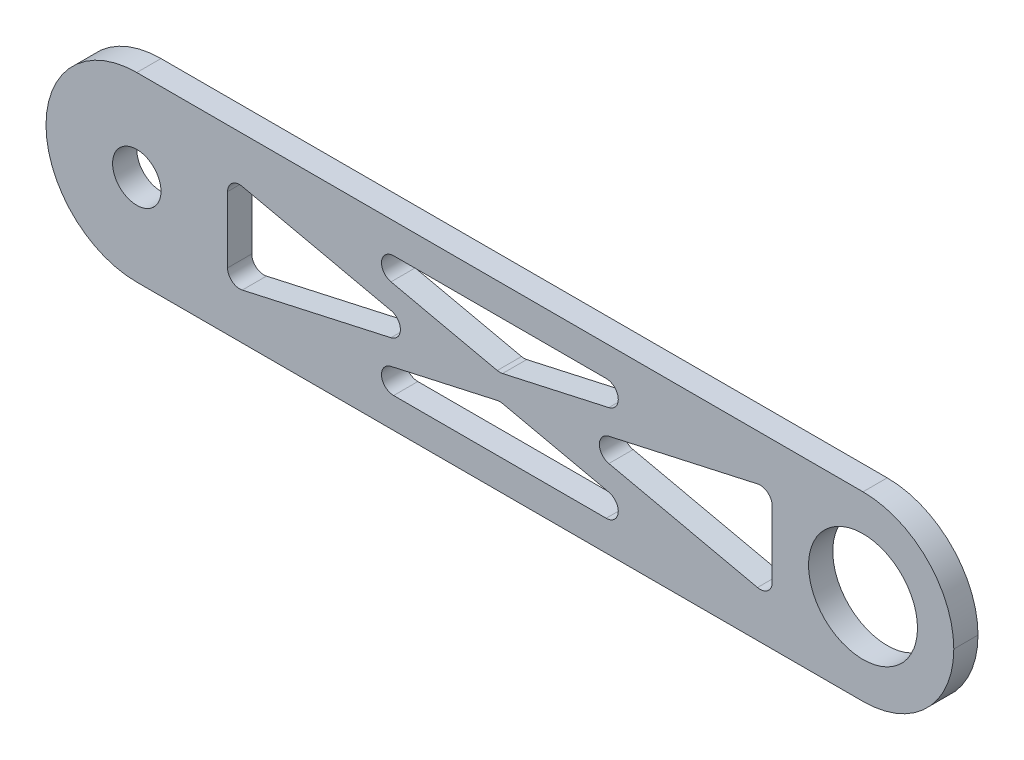
from build123d import *

# Parameters (mm, degrees)
SKETCH_1_W          = 75
SKETCH_1_H          = 15
EXTRUDE_1_DEPTH     = 2
FILLET_1_R          = 7.5
SKETCH_2_R          = 4.5
SKETCH_2_R_2        = 2
CUT_EXTRUDE_1_DEPTH = 2
CUT_EXTRUDE_3_DEPTH = 10
FILLET_5_R          = 1


with BuildPart() as part:
    # 草图1 → 凸台-拉伸1 (new body)
    with BuildSketch(Plane.XY):
        Rectangle(SKETCH_1_W, SKETCH_1_H)
    extrude(amount=EXTRUDE_1_DEPTH)

    # 圆角1
    fillet_1_edges = [part.edges().sort_by_distance(p)[0] for p in [
        (37.5, -7.5, 1),
        (-37.5, -7.5, 1),
        (-37.5, 7.5, 1),
        (37.5, 7.5, 1),
    ]]
    fillet(fillet_1_edges, radius=FILLET_1_R - 0.0001)  # a hair under: the kernel refuses the full size

    # 草图2 → 切除-拉伸1 (cut)
    with BuildSketch(Plane.XY.offset(2)):
        with Locations((30, 0)):
            Circle(SKETCH_2_R)
        with Locations((-30, 0)):
            Circle(SKETCH_2_R_2)
    extrude(amount=-CUT_EXTRUDE_1_DEPTH, mode=Mode.SUBTRACT)

    # 草图3 → 切除-拉伸3 (cut)
    with BuildSketch(Plane.XY.offset(2)):
        Polygon((-17.890227771, -5), (0, -1.024393829), (17.890227771, -5), align=None)
        Polygon((-22.5, -3.975606171), (-22.5, 3.975606171), (-4.609772229, 0), align=None)
        Polygon((-17.890227771, 5), (17.890227771, 5), (0, 1.024393829), align=None)
        Polygon((22.5, -3.975606171), (22.5, 3.975606171), (4.609772229, 0), align=None)
    extrude(amount=-CUT_EXTRUDE_3_DEPTH, mode=Mode.SUBTRACT)

    # 圆角5
    fillet_5_edges = [part.edges().sort_by_distance(p)[0] for p in [
        (0, 1.024393829, 1),
        (-17.890227771, 5, 1),
        (17.890227771, 5, 1),
        (4.609772229, 0, 1),
        (22.5, 3.975606171, 1),
        (22.5, -3.975606171, 1),
        (0, -1.024393829, 1),
        (17.890227771, -5, 1),
        (-17.890227771, -5, 1),
        (-22.5, 3.975606171, 1),
        (-4.609772229, 0, 1),
        (-22.5, -3.975606171, 1),
    ]]
    fillet(fillet_5_edges, radius=FILLET_5_R)


solid = part.part
